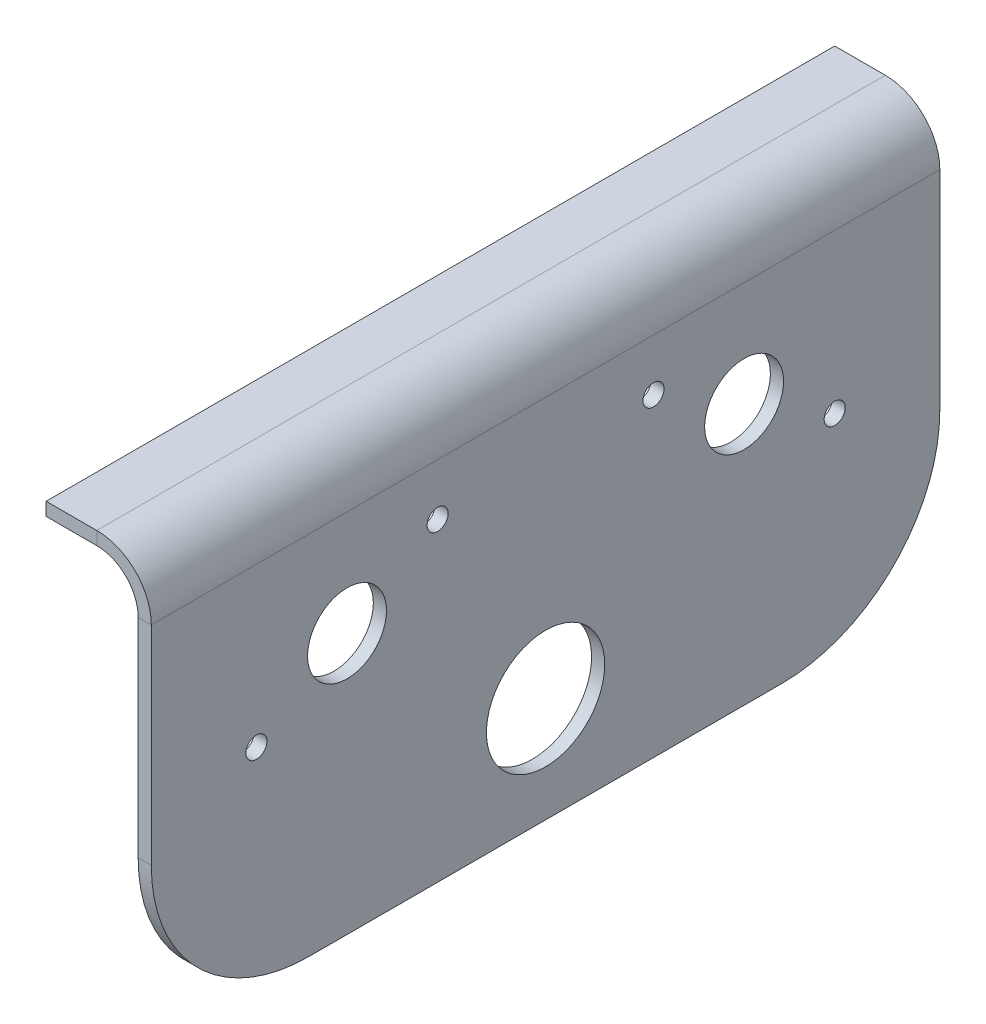
from build123d import *

# Parameters (mm, degrees)
SKETCH1_W                    = 190.5
SKETCH1_H                    = 101.6
BOSS_EXTRUDE1_DEPTH          = 3.175
SKETCH2_R                    = 14.2875
CUT_EXTRUDE1_DEPTH           = 3.175
EDGE_FLANGE1_STRIP_W         = 32.7
EDGE_FLANGE1_STRIP_H         = 3.175
EDGE_FLANGE1_STRIP_CUT_DEPTH = 190.5
EDGE_FLANGE1_DEPTH           = 190.5
SKETCH12_R                   = 9.525
SKETCH12_R_2                 = 2.54
CUT_EXTRUDE2_DEPTH           = 7.62
FILLET1_R                    = 38.1


# Sheet-metal steps are written as plain solids
with BuildPart() as part:
    # Sketch1 → Boss-Extrude1 (new body)
    with BuildSketch(Plane(origin=(0, 0, 0), x_dir=(0, 0, -1), z_dir=(1, 0, 0))):
        Rectangle(SKETCH1_W, SKETCH1_H)
    extrude(amount=BOSS_EXTRUDE1_DEPTH)

    # Sketch2 → Cut-Extrude1 (cut)
    with BuildSketch(Plane(origin=(3.175, 0, 0), x_dir=(0, 0, -1), z_dir=(1, 0, 0))):
        with Locations((0, -25.4)):
            Circle(SKETCH2_R)
    extrude(amount=-CUT_EXTRUDE1_DEPTH, mode=Mode.SUBTRACT)

    # Edge-Flange1 strip (across the edge) → Edge-Flange1 strip cut (cut)
    with BuildSketch(Plane(origin=(0, 50.8, 95.25), x_dir=(0, -1, 0), z_dir=(0, 0, -1))):
        with Locations((-3.175, -1.5875)):
            Rectangle(EDGE_FLANGE1_STRIP_W, EDGE_FLANGE1_STRIP_H)
    extrude(amount=EDGE_FLANGE1_STRIP_CUT_DEPTH, mode=Mode.SUBTRACT)

    # Edge-Flange1 section (across the edge) → Edge-Flange1 (add)
    with BuildSketch(Plane(origin=(0, 50.8, 95.25), x_dir=(0, -1, 0), z_dir=(0, 0, -1))):
        with BuildLine():
            Line((0, 10), (0, 22.225))
            Line((0, 22.225), (3.175, 22.225))
            Line((3.175, 22.225), (3.175, 10))
            ThreePointArc((3.175, 10), (6.103932188, 2.928932188), (13.175, 0))
            Line((13.175, 0), (13.175, -3.175))
            ThreePointArc((13.175, -3.175), (3.858868158, 0.683868158), (0, 10))
        make_face()
    extrude(amount=EDGE_FLANGE1_DEPTH)

    # Sketch12 → Cut-Extrude2 (cut)
    with BuildSketch(Plane(origin=(3.175, 0, 0), x_dir=(0, 0, -1), z_dir=(1, 0, 0))):
        with Locations((-47.963329482, 12.225)):
            Circle(SKETCH12_R)
        with Locations((-26.076658964, 25.11428445)):
            Circle(SKETCH12_R_2)
        with Locations((-69.85, -0.66428445)):
            Circle(SKETCH12_R_2)
        with Locations((47.963329482, 12.225)):
            Circle(SKETCH12_R)
        with Locations((26.076658964, 25.11428445)):
            Circle(SKETCH12_R_2)
        with Locations((69.85, -0.66428445)):
            Circle(SKETCH12_R_2)
    extrude(amount=-CUT_EXTRUDE2_DEPTH, mode=Mode.SUBTRACT)

    # Fillet1
    fillet1_edges = [part.edges().sort_by_distance(p)[0] for p in [
        (1.5875, -50.8, 95.25),
        (1.5875, -50.8, -95.25),
    ]]
    fillet(fillet1_edges, radius=FILLET1_R)


solid = part.part
